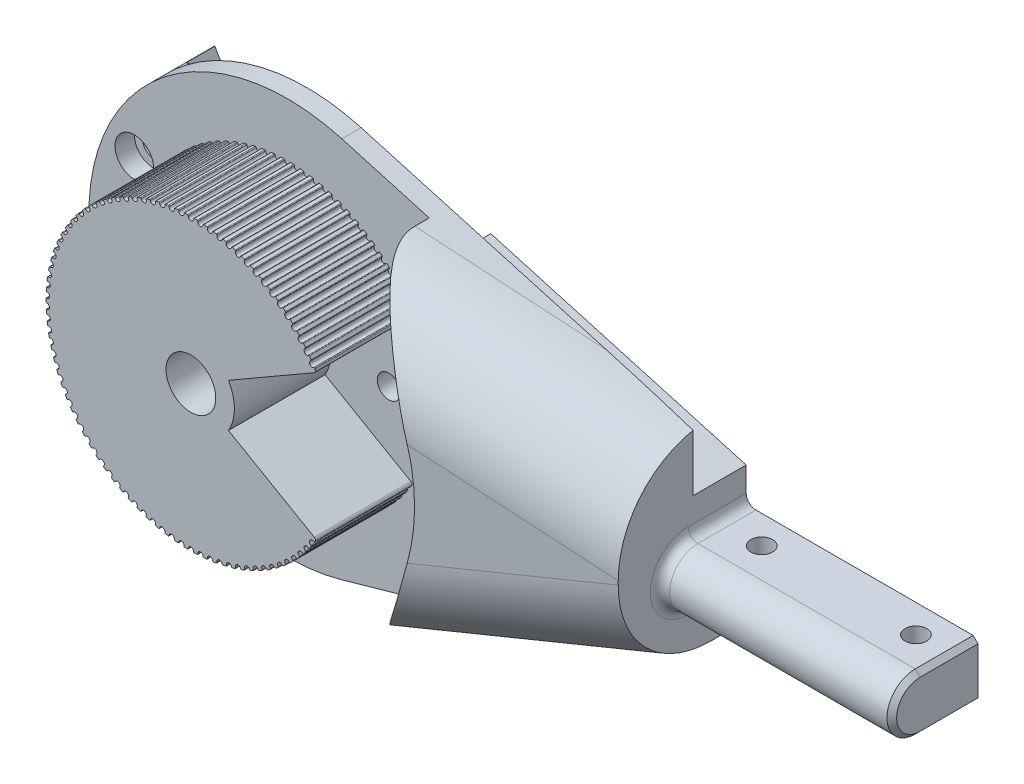
from build123d import *

# Parameters (mm, degrees)
RESSALTO_EXTRUS_O1_DEPTH          = 35
ESBO_O2_R                         = 45.22393492
ESBO_O2_R_2                       = 30
CORTE_EXTRUS_O1_DEPTH             = 20
CORTE_EXTRUS_O2_DEPTH             = 20
CHANFRO1_SIZE                     = 8.502262467
CHANFRO1_SIZE_2                   = 40
FILETE4_R                         = 20
CORTE_EXTRUS_O5_DEPTH             = 6
CORTE_EXTRUS_O6_DEPTH             = 11
CHANFRO2_SIZE                     = 10
RESSALTO_EXTRUS_O2_DEPTH          = 48
FILETE5_R                         = 2
CHANFRO3_SIZE                     = 1
ESBO_O10_R                        = 2.25
CORTE_EXTRUS_O7_DEPTH             = 342.284989002
ESBO_O11_R                        = 5.15
CORTE_EXTRUS_O8_DEPTH             = 367.917618413
REBAIXO_PARA_SHCS_M41_D           = 4.5
REBAIXO_PARA_SHCS_M41_CBORE_D     = 8
REBAIXO_PARA_SHCS_M41_CBORE_DEPTH = 4
CORTE_EXTRUS_O9_DEPTH             = 20
FILETE7_R                         = 0.5
ESBO_O20_R                        = 2.4
CORTE_EXTRUS_O10_DEPTH            = 366.791660241
FILETE8_R                         = 0.15
PADR_OCIRCULAR3_COUNT             = 94
PADR_OCIRCULAR3_ANGLE             = 356.19
FILETE8_OF_PADR_OCIRCULAR3_R      = 0.15


with BuildPart() as part:
    # Esboço1 → Ressalto-extrusão1 (new body)
    with BuildSketch(Plane.XY):
        with BuildLine():
            Line((288.88140452, 120), (288.88140452, 80))
            Line((288.88140452, 80), (220.127979697, 60.449355997))
            ThreePointArc((220.127979697, 60.449355997), (167.76280904, 100), (220.127979697, 139.550644003))
            Line((220.127979697, 139.550644003), (288.88140452, 120))
        make_face()
    extrude(amount=RESSALTO_EXTRUS_O1_DEPTH)

    # Esboço2 → Corte-extrusão1 (cut)
    with BuildSketch(Plane.XY.offset(35)):
        with Locations((208.88140452, 100)):
            Circle(ESBO_O2_R)
        with Locations((208.88140452, 100)):
            Circle(ESBO_O2_R_2, mode=Mode.SUBTRACT)
    extrude(amount=-CORTE_EXTRUS_O1_DEPTH, mode=Mode.SUBTRACT)

    # Esboço3 → Corte-extrusão2 (cut)
    with BuildSketch(Plane.XY.offset(35)):
        with BuildLine():
            Line((208.33140452, 129.8), (208.33140452, 129.99495791))
            ThreePointArc((208.33140452, 129.99495791), (208.88140452, 130), (209.43140452, 129.99495791))
            Line((209.43140452, 129.99495791), (209.43140452, 129.8))
            ThreePointArc((209.43140452, 129.8), (208.88140452, 129.25), (208.33140452, 129.8))
        make_face()
    corte_extrus_o2 = extrude(amount=-CORTE_EXTRUS_O2_DEPTH, mode=Mode.SUBTRACT)

    # Chanfro1
    # the kernel refuses this chamfer: 40, 8.502262467 mm, written as the material it takes off along each edge
    with BuildSketch(Plane(origin=(288.88140452, 223.915918321, 35), x_dir=(0, 0, -1), z_dir=(0, -1, 0))) as chanfro1_piece_1:
        Polygon((CHANFRO1_SIZE, 0), (0, -CHANFRO1_SIZE_2), (0, 0), align=None)
    extrude(amount=247.831836643, mode=Mode.SUBTRACT)

    # Filete4
    filete4_edges = [part.edges().sort_by_distance(p)[0] for p in [
        (268.88140452, 125.687176763, 30.748868766),
        (268.88140452, 74.312823237, 30.748868767),
    ]]
    fillet(filete4_edges, radius=FILETE4_R)

    # Esboço6 → Corte-extrusão5 (cut)
    with BuildSketch(Plane(origin=(0, 0, 0), x_dir=(-1, 0, 0), z_dir=(0, 0, -1))):
        with BuildLine():
            Line((-245.2234198, 138.946216915), (-219.273709365, 94))
            ThreePointArc((-219.273709365, 94), (-208.88140452, 88), (-198.489099675, 94))
            Line((-198.489099675, 94), (-172.539389239, 138.946216915))
            Line((-172.539389239, 138.946216915), (-245.2234198, 138.946216915))
        make_face()
    extrude(amount=-CORTE_EXTRUS_O5_DEPTH, mode=Mode.SUBTRACT)

    # Esboço8 → Corte-extrusão6 (cut)
    with BuildSketch(Plane(origin=(0, 0, 0), x_dir=(-1, 0, 0), z_dir=(0, 0, -1))):
        Polygon((-344.319073229, 92.151969402), (-179.171530951, 139.11313265), (-188.948158446, 165.308096575), (-312.412325844, 131.875927391), align=None)
    extrude(amount=-CORTE_EXTRUS_O6_DEPTH, mode=Mode.SUBTRACT)

    # Chanfro2
    # the kernel refuses this chamfer: 22.612495948, 10 mm, written as the material it takes off along each edge
    with BuildSketch(Plane(origin=(189.392572811, 136.206689062, 11), x_dir=(-0.7913619734687142, -0.6113478771924395, 0), z_dir=(0, 0, -1))) as chanfro2_piece_1:
        with BuildLine():
            Line((13.424324353, 0), (-CHANFRO2_SIZE * 0.593972278099, -CHANFRO2_SIZE * 0.804485508167))
            Line((-CHANFRO2_SIZE * 0.593972278099, -CHANFRO2_SIZE * 0.804485508167), (0, 0))
            ThreePointArc((0, 0), (7.133656498, 0.549382314), (13.424324353, 0))
        make_face()
    extrude(amount=40.659571502, mode=Mode.SUBTRACT)

    # Esboço9 → Ressalto-extrusão2 (add)
    with BuildSketch(Plane(origin=(288.88140452, 0, 0), x_dir=(0, 0, -1), z_dir=(1, 0, 0))):
        with BuildLine():
            Line((-12, 100.85), (0, 100.85))
            Line((0, 100.85), (0, 89.15))
            Line((0, 89.15), (-12, 89.15))
            ThreePointArc((-12, 89.15), (-17.85, 95), (-12, 100.85))
        make_face()
    extrude(amount=RESSALTO_EXTRUS_O2_DEPTH)

    # Filete5
    filete5_edges = [part.edges().sort_by_distance(p)[0] for p in [
        (288.88140452, 100.85, 6),
        (288.88140452, 95, 17.85),
        (288.88140452, 89.15, 6),
    ]]
    fillet(filete5_edges, radius=FILETE5_R)

    # Chanfro3
    chanfro3_edges = [part.edges().sort_by_distance(p)[0] for p in [
        (336.88140452, 100.85, 6),
        (336.88140452, 95, 17.85),
        (336.88140452, 89.15, 6),
    ]]
    chamfer(chanfro3_edges, length=CHANFRO3_SIZE)

    # Esboço10 → Corte-extrusão7 (cut, through all)
    with BuildSketch(Plane(origin=(0, 100.85, 0), x_dir=(1, 0, 0), z_dir=(0, 1, 0))):
        with Locations(Location((329.846296891, -5.820004728, 0), (0, 0, 270))):
            Circle(ESBO_O10_R)
        with Locations(Location((297.910035946, -5.820004728, 0), (0, 0, 270))):
            Circle(ESBO_O10_R)
    extrude(amount=-CORTE_EXTRUS_O7_DEPTH, mode=Mode.SUBTRACT)

    # Esboço11 → Corte-extrusão8 (cut, through all)
    with BuildSketch(Plane(origin=(0, 0, 0), x_dir=(-1, 0, 0), z_dir=(0, 0, -1))):
        with Locations((-208.88140452, 100)):
            Circle(ESBO_O11_R)
    extrude(amount=-CORTE_EXTRUS_O8_DEPTH, mode=Mode.SUBTRACT)

    # Rebaixo para SHCS M41 (through all)
    with Locations(Plane.XY.offset(15)):
        with Locations((177.163010847, 114.796739602), (208.88140452, 65), (240.599798192, 114.796739602)):
            CounterBoreHole(REBAIXO_PARA_SHCS_M41_D / 2, REBAIXO_PARA_SHCS_M41_CBORE_D / 2, REBAIXO_PARA_SHCS_M41_CBORE_DEPTH)

    # Esboço19 → Corte-extrusão9 (cut)
    with BuildSketch(Plane.XY.offset(35)):
        with BuildLine():
            Line((216.675633154, 104.5), (234.862166633, 115))
            ThreePointArc((234.862166633, 115), (238.88140452, 100), (234.862166633, 85))
            Line((234.862166633, 85), (216.675633154, 95.5))
            ThreePointArc((216.675633154, 95.5), (217.88140452, 100), (216.675633154, 104.5))
        make_face()
    extrude(amount=-CORTE_EXTRUS_O9_DEPTH, mode=Mode.SUBTRACT)

    # Filete7
    filete7_edges = [part.edges().sort_by_distance(p)[0] for p in [
        (234.862166633, 115, 25),
        (234.862166633, 85, 25),
    ]]
    fillet(filete7_edges, radius=FILETE7_R)

    # Esboço20 → Corte-extrusão10 (cut, through all)
    with BuildSketch(Plane.XY.offset(15)):
        with Locations((229.88140452, 100)):
            Circle(ESBO_O20_R)
    extrude(amount=-CORTE_EXTRUS_O10_DEPTH, mode=Mode.SUBTRACT)

    # Filete8
    filete8_edges = [part.edges().sort_by_distance(p)[0] for p in [
        (208.33140452, 129.99495791, 25),
        (209.43140452, 129.99495791, 25),
    ]]
    fillet(filete8_edges, radius=FILETE8_R)

    # PadrãoCircular3: Corte-extrusão2 ×94 about axis, 16 skipped
    padr_ocircular3_axis = Axis((208.88140452, 100, 0), (0, 0, 1))
    add([corte_extrus_o2.rotate(padr_ocircular3_axis, i * PADR_OCIRCULAR3_ANGLE / (PADR_OCIRCULAR3_COUNT - 1)) for i in range(1, PADR_OCIRCULAR3_COUNT) if i not in (63, 64, 65, 66, 67, 68, 69, 70, 71, 72, 73, 74, 75, 76, 77, 78)], mode=Mode.SUBTRACT)

    # Filete8 of PadrãoCircular3
    filete8_of_padr_ocircular3_edges = [part.edges().sort_by_distance(p)[0] for p in [
        (206.329079499, 129.891230102, 25),
        (207.426622792, 129.964706074, 25),
        (204.338155047, 129.653985975, 25),
        (205.428339195, 129.800609723, 25),
        (202.367524104, 129.284285238, 25),
        (203.445479538, 129.503401831, 25),
        (200.425988963, 128.783779247, 25),
        (201.486900739, 129.074409948, 25),
        (198.522221956, 128.154703632, 25),
        (199.561351257, 128.515550269, 25),
        (196.664726711, 127.399868308, 25),
        (197.677432018, 127.829319075, 25),
        (194.861800176, 126.522644929, 25),
        (195.843557999, 127.018781581, 25),
        (193.121495552, 125.526951822, 25),
        (194.067920635, 126.087558245, 25),
        (191.451586325, 124.417236488, 25),
        (192.358451235, 125.0398086, 25),
        (189.859531544, 123.198455735, 25),
        (190.722785552, 123.88021267, 25),
        (188.352442502, 121.876053539, 25),
        (189.168229677, 122.613950067, 25),
        (186.937050971, 120.455936726, 25),
        (187.701727406, 121.246676854, 25),
        (185.619679137, 118.944448585, 25),
        (186.329829221, 119.784500285, 25),
        (184.406211355, 117.348340541, 25),
        (185.058663033, 118.233951521, 25),
        (183.302067868, 115.67474199, 25),
        (183.89390681, 116.601956457, 25),
        (182.312180598, 113.93112846, 25),
        (182.840763213, 114.895804789, 25),
        (181.440971112, 112.125288218, 25),
        (181.903936359, 113.123117452, 25),
        (180.692330875, 110.26528748, 25),
        (181.087610811, 111.291812576, 25),
        (180.069603869, 108.359434384, 25),
        (180.39543288, 109.410070123, 25),
        (179.575571651, 106.416241878, 25),
        (179.830494344, 107.486295344, 25),
        (179.212440934, 104.444389695, 25),
        (179.395318638, 105.529081239, 25),
        (178.98183373, 102.452685584, 25),
        (179.091849576, 103.547170172, 25),
        (178.884780099, 100.450025967, 25),
        (178.921442676, 101.549414822, 25),
        (178.921713556, 98.445356201, 25),
        (178.884859101, 99.544738641, 25),
        (179.092469128, 96.447630624, 25),
        (178.98226226, 97.542095994, 25),
        (179.396284094, 94.465772552, 25),
        (179.213217079, 95.550432162, 25),
        (179.831801392, 92.50863443, 25),
        (179.576691942, 93.578643387, 25),
        (180.397075681, 90.584958281, 25),
        (180.071063304, 91.635537135, 25),
        (181.089582027, 88.703336664, 25),
        (180.694122935, 89.729792755, 25),
        (181.906227186, 86.872174292, 25),
        (181.443087792, 87.869922707, 25),
        (182.843363418, 85.099650489, 25),
        (182.314612443, 86.064234548, 25),
        (183.896804778, 83.393682655, 25),
        (183.304804016, 84.320793812, 25),
        (185.061845821, 81.761890904, 25),
        (184.409239584, 82.647387996, 25),
        (186.333282611, 80.211564024, 25),
        (185.622985921, 81.051491766, 25),
        (187.705435973, 78.749626918, 25),
        (186.94062154, 79.540233573, 25),
        (189.172176856, 77.38260968, 25),
        (188.356260906, 78.120363814, 25),
        (190.726953712, 76.116618417, 25),
        (189.863580728, 76.798224675, 25),
        (192.362821758, 74.957307982, 25),
        (191.455848202, 75.579721807, 25),
        (194.072473999, 73.909856711, 25),
        (193.125951086, 74.470297944, 25),
        (195.848273865, 72.978943297, 25),
        (194.866429464, 73.474908592, 25),
        (197.682289322, 72.168725887, 25),
        (196.669509077, 72.597999896, 25),
        (199.566328301, 71.482823509, 25),
        (198.527136036, 71.843488778, 25),
        (201.491975293, 70.92429991, 25),
        (200.431012809, 71.214745443, 25),
        (203.450628936, 70.495649871, 25),
        (202.372635275, 70.714578321, 25),
        (205.433540435, 70.198788057, 25),
        (204.343330713, 70.34522153, 25),
        (207.431852642, 70.035040475, 25),
        (206.334296541, 70.108324889, 25),
        (209.436639619, 70.00513854, 25),
        (208.336639636, 70.004946554, 25),
        (211.438946506, 70.109215818, 25),
        (210.341416053, 70.035548289, 25),
        (213.429829521, 70.346807423, 25),
        (212.33967098, 70.199993405, 25),
        (215.400395909, 70.716852094, 25),
        (214.322478734, 70.497547366, 25),
        (217.341843665, 71.217696939, 25),
        (216.28098263, 70.926881079, 25),
        (219.245500849, 71.847104815, 25),
        (218.206434544, 71.486076821, 25),
        (221.102864322, 72.602264321, 25),
        (220.090233983, 72.172636811, 25),
        (222.905637725, 73.479802357, 25),
        (221.923966509, 72.983494364, 25),
        (224.645768541, 74.47579919, 25),
        (223.699441317, 73.915027593, 25),
        (226.315484061, 75.585805961, 25),
        (225.408727824, 74.96307558, 25),
        (227.9073261, 76.804864561, 25),
        (227.044191095, 76.12295697, 25),
        (229.414184317, 78.127529774, 25),
        (228.598525941, 77.389490876, 25),
        (230.829327969, 79.547893598, 25),
        (230.064789556, 78.75702002, 25),
        (232.146435979, 81.05961164, 25),
        (231.436432522, 80.219436009, 25),
        (233.359625169, 82.65593145, 25),
        (232.707328069, 81.77020661, 25),
        (234.463476541, 84.329722685, 25),
        (233.871799438, 83.402404937, 25),
        (233.863105532, 116.610677727, 25),
        (234.455268096, 115.683669908, 25),
        (232.697779706, 118.242266115, 25),
        (233.350540481, 117.356882938, 25),
        (231.426072352, 119.792371065, 25),
        (232.136515626, 118.952567305, 25),
        (230.053663854, 121.254068662, 25),
        (230.818616263, 120.463595504, 25),
        (228.586684404, 122.620829885, 25),
        (229.402729104, 121.883218166, 25),
        (227.031686615, 123.886549769, 25),
        (227.895178548, 123.205094208, 25),
        (225.395616256, 125.045574673, 25),
        (226.30269843, 124.423319154, 25),
        (223.685781227, 126.092727537, 25),
        (224.632401941, 125.532451513, 25),
        (221.909818913, 127.023331001, 25),
        (222.89174986, 126.527537078, 25),
        (220.075662074, 127.833228304, 25),
        (221.088517226, 127.404131064, 25),
        (218.191503411, 128.518801844, 25),
        (219.230758608, 128.158317953, 25),
        (216.265758967, 129.076989346, 25),
        (217.326772127, 128.786728991, 25),
        (214.307030541, 129.505297529, 25),
        (215.385062396, 129.286557227, 25),
        (212.32406726, 129.801813255, 25),
        (213.414302523, 129.655570062, 25),
        (210.325726503, 129.965212063, 25),
        (211.423295378, 129.89211921, 25),
    ]]
    fillet(filete8_of_padr_ocircular3_edges, radius=FILETE8_OF_PADR_OCIRCULAR3_R)


solid = part.part
